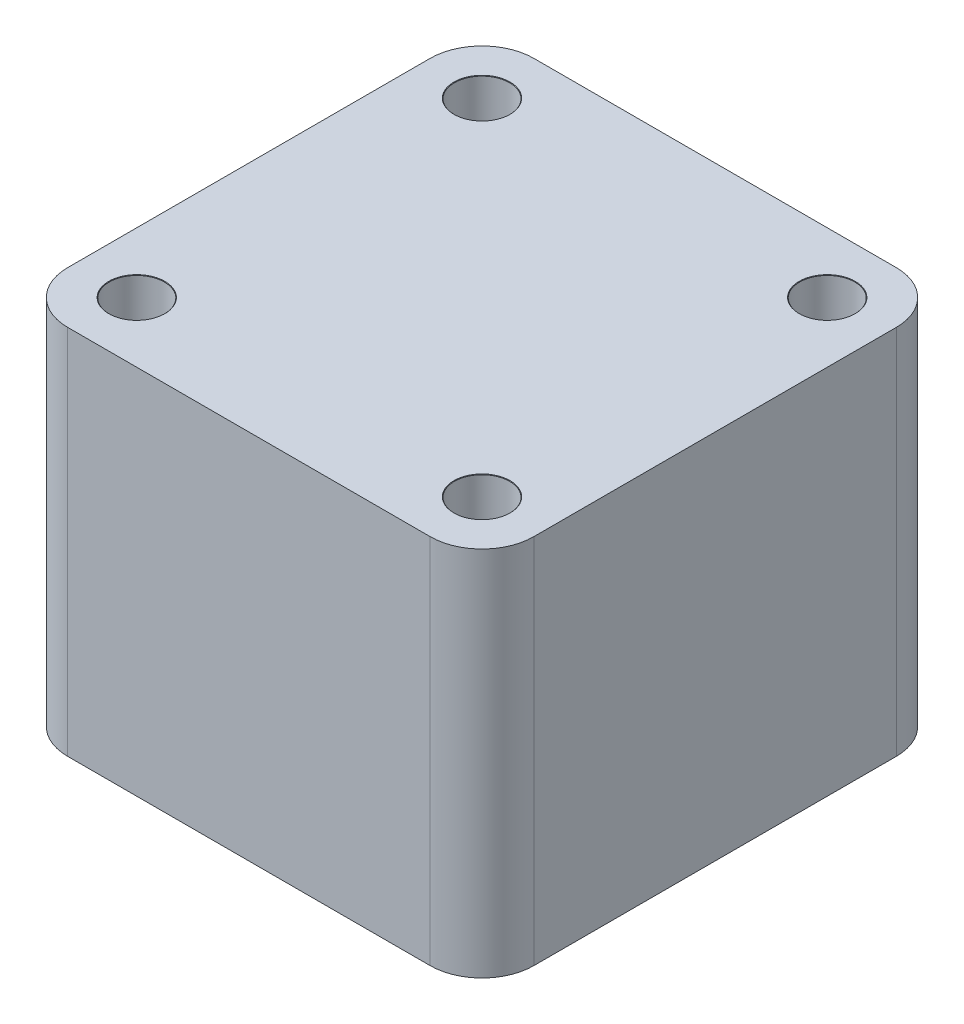
from build123d import *

# Parameters (mm, degrees)
SKETCH1_W                     = 27
SKETCH1_H                     = 27
BOSS_EXTRUDE1_DEPTH           = 21.525
M3_CLEARANCE_HOLE1_AT_2_COUNT = 2
M3_CLEARANCE_HOLE1_AT_2_PITCH = 20
M3_CLEARANCE_HOLE1_AT_3_COUNT = 2
M3_CLEARANCE_HOLE1_AT_3_PITCH = 28.284271247
M3_CLEARANCE_HOLE1_AT_4_COUNT = 2
M3_CLEARANCE_HOLE1_AT_4_PITCH = 20
FILLET1_R                     = 3


with BuildPart() as part:
    # Sketch1 → Boss-Extrude1 (new body)
    with BuildSketch(Plane(origin=(0, 0, 0), x_dir=(1, 0, 0), z_dir=(0, 1, 0))):
        Rectangle(SKETCH1_W, SKETCH1_H)
    extrude(amount=BOSS_EXTRUDE1_DEPTH)

    # Sketch4 → M3 Clearance Hole1 (revolve, cut)
    with BuildSketch(Plane(origin=(10, 0, -10), x_dir=(0, 0, -1), z_dir=(1, 0, 0))):
        Polygon((0, 0), (0, 21.525), (1.625, 21.525), (1.6, 21.5), (1.6, 0.025), (1.625, 0), align=None)
    m3_clearance_hole1 = revolve(axis=Axis((10, -6.35, -10), (0, 1, 0)), mode=Mode.SUBTRACT)

    # M3 Clearance Hole1 at 2: M3 Clearance Hole1 ×2
    with Locations(*[(-i * M3_CLEARANCE_HOLE1_AT_2_PITCH, 0, 0) for i in range(1, M3_CLEARANCE_HOLE1_AT_2_COUNT)]):
        add(m3_clearance_hole1, mode=Mode.SUBTRACT)

    # M3 Clearance Hole1 at 3: M3 Clearance Hole1 ×2
    with Locations(*[Vector(-0.7071067811865476, 0, 0.7071067811865475) * (i * M3_CLEARANCE_HOLE1_AT_3_PITCH) for i in range(1, M3_CLEARANCE_HOLE1_AT_3_COUNT)]):
        add(m3_clearance_hole1, mode=Mode.SUBTRACT)

    # M3 Clearance Hole1 at 4: M3 Clearance Hole1 ×2
    with Locations(*[(0, 0, i * M3_CLEARANCE_HOLE1_AT_4_PITCH) for i in range(1, M3_CLEARANCE_HOLE1_AT_4_COUNT)]):
        add(m3_clearance_hole1, mode=Mode.SUBTRACT)

    # Fillet1
    fillet1_edges = [part.edges().sort_by_distance(p)[0] for p in [
        (13.5, 10.7625, 13.5),
        (-13.5, 10.7625, 13.5),
        (13.5, 10.7625, -13.5),
        (-13.5, 10.7625, -13.5),
    ]]
    fillet(fillet1_edges, radius=FILLET1_R)


solid = part.part
